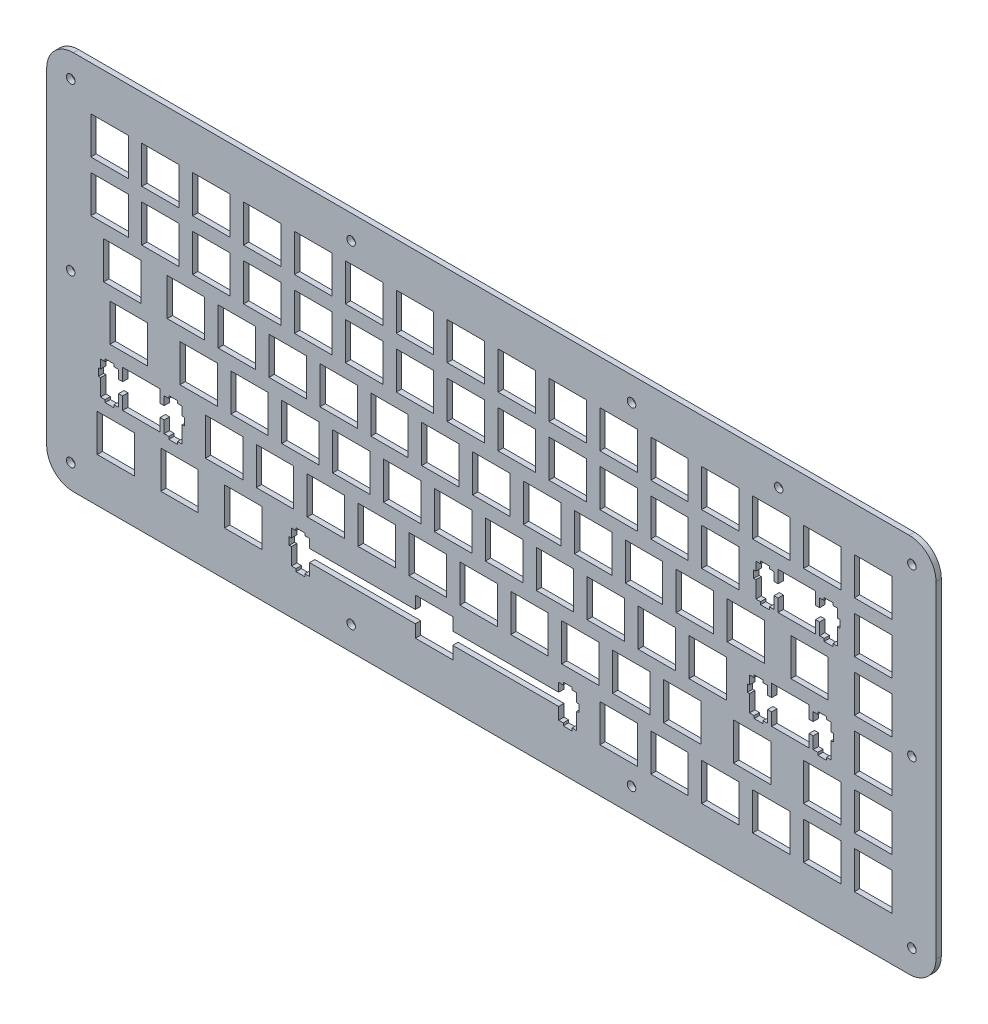
from build123d import *

# Parameters (mm, degrees)
SKETCH_1_R      = 1.59992
SKETCH_1_R_2    = 1.5998
SKETCH_1_R_3    = 1.6
EXTRUDE_1_DEPTH = 2
SKETCH_1_3_W    = 13.9995
SKETCH_1_3_H    = 14.0009
SKETCH_1_3_W_2  = 14.0007
SKETCH_1_3_W_3  = 13.9997
SKETCH_1_3_W_4  = 13.9996
SKETCH_1_3_H_2  = 13.9997
SKETCH_1_3_W_5  = 14.0009
SKETCH_1_3_H_3  = 13.9996
SKETCH_1_3_W_6  = 14.0001
SKETCH_1_3_W_7  = 14
SKETCH_1_3_W_8  = 13.999
SKETCH_1_3_W_9  = 13.9994
SKETCH_1_3_W_10 = 14.0008
SKETCH_1_3_H_4  = 13.9992
SKETCH_1_3_W_11 = 14.001
SKETCH_1_3_H_5  = 14
EXTRUDE_2_DEPTH = 2


with BuildPart() as part:
    # 草图1 → 凸台-拉伸1 (new body)
    with BuildSketch(Plane.XY):
        with BuildLine():
            Line((143.903291321, 67.766258356), (-168.898624079, 67.766258356))
            ThreePointArc((-168.898624079, 67.766258356), (-175.969691891, 64.837326167), (-178.898624079, 57.766258356))
            Line((-178.898624079, 57.766258356), (-178.898624079, -64.535827644))
            ThreePointArc((-178.898624079, -64.535827644), (-175.969691891, -71.606895456), (-168.898624079, -74.535827644))
            Line((-168.898624079, -74.535827644), (143.903291321, -74.535827644))
            ThreePointArc((143.903291321, -74.535827644), (150.974359133, -71.606895456), (153.903291321, -64.535827644))
            Line((153.903291321, -64.535827644), (153.903291321, 57.766258356))
            ThreePointArc((153.903291321, 57.766258356), (150.974359133, 64.837326167), (143.903291321, 67.766258356))
        make_face()
        with Locations((-169.898638679, -65.535841644)):
            Circle(SKETCH_1_R, mode=Mode.SUBTRACT)
        with Locations((-64.964708679, -65.535841644)):
            Circle(SKETCH_1_R, mode=Mode.SUBTRACT)
        with Locations((-169.898638679, -3.384841644)):
            Circle(SKETCH_1_R_2, mode=Mode.SUBTRACT)
        with Locations((39.968291321, -65.535841644)):
            Circle(SKETCH_1_R, mode=Mode.SUBTRACT)
        with Locations((144.903291321, -65.535841644)):
            Circle(SKETCH_1_R, mode=Mode.SUBTRACT)
        with Locations((144.903291321, -3.384841644)):
            Circle(SKETCH_1_R_2, mode=Mode.SUBTRACT)
        with BuildLine():
            ThreePointArc((-73.964708679, 56.241258356), (-73.378922242, 54.827044793), (-71.964708679, 54.241258356))
            Line((-71.964708679, 54.241258356), (-57.964708679, 54.241258356))
            ThreePointArc((-57.964708679, 54.241258356), (-56.550495117, 54.827044793), (-55.964708679, 56.241258356))
            Line((-55.964708679, 56.241258356), (-55.964708679, 59.766258356))
            ThreePointArc((-55.964708679, 59.766258356), (-55.378922242, 61.180471918), (-53.964708679, 61.766258356))
            Line((-53.964708679, 61.766258356), (28.968291321, 61.766258356))
            ThreePointArc((28.968291321, 61.766258356), (30.382504883, 61.180471918), (30.968291321, 59.766258356))
            Line((30.968291321, 59.766258356), (30.968291321, 56.241258356))
            ThreePointArc((30.968291321, 56.241258356), (31.554077758, 54.827044793), (32.968291321, 54.241258356))
            Line((32.968291321, 54.241258356), (46.968291321, 54.241258356))
            ThreePointArc((46.968291321, 54.241258356), (48.382504883, 54.827044793), (48.968291321, 56.241258356))
            Line((48.968291321, 56.241258356), (48.968291321, 59.766258356))
            ThreePointArc((48.968291321, 59.766258356), (49.554077758, 61.180471918), (50.968291321, 61.766258356))
            Line((50.968291321, 61.766258356), (84.036291321, 61.766258356))
            ThreePointArc((84.036291321, 61.766258356), (85.450504883, 61.180471918), (86.036291321, 59.766258356))
            Line((86.036291321, 59.766258356), (86.036291321, 56.241258356))
            ThreePointArc((86.036291321, 56.241258356), (86.622077758, 54.827044793), (88.036291321, 54.241258356))
            Line((88.036291321, 54.241258356), (102.036291321, 54.241258356))
            ThreePointArc((102.036291321, 54.241258356), (103.450504883, 54.827044793), (104.036291321, 56.241258356))
            Line((104.036291321, 56.241258356), (104.036291321, 59.766258356))
            ThreePointArc((104.036291321, 59.766258356), (104.622077758, 61.180471918), (106.036291321, 61.766258356))
            Line((106.036291321, 61.766258356), (133.903291321, 61.766258356))
            ThreePointArc((133.903291321, 61.766258356), (135.317504883, 61.180471918), (135.903291321, 59.766258356))
            Line((135.903291321, 59.766258356), (135.903291321, 56.241258356))
            ThreePointArc((135.903291321, 56.241258356), (136.489077758, 54.827044793), (137.903291321, 54.241258356))
            Line((137.903291321, 54.241258356), (138.376291321, 54.241258356))
            ThreePointArc((138.376291321, 54.241258356), (139.790504883, 53.655471918), (140.376291321, 52.241258356))
            Line((140.376291321, 52.241258356), (140.376291321, 51.766258356))
            ThreePointArc((140.376291321, 51.766258356), (140.962077758, 50.352044793), (142.376291321, 49.766258356))
            Line((142.376291321, 49.766258356), (145.903291321, 49.766258356))
            ThreePointArc((145.903291321, 49.766258356), (147.317504883, 49.180471918), (147.903291321, 47.766258356))
            Line((147.903291321, 47.766258356), (147.903291321, 7.615158356))
            ThreePointArc((147.903291321, 7.615158356), (147.317504883, 6.200944793), (145.903291321, 5.615158356))
            Line((145.903291321, 5.615158356), (142.376291321, 5.615158356))
            ThreePointArc((142.376291321, 5.615158356), (140.962077758, 5.029371918), (140.376291321, 3.615158356))
            Line((140.376291321, 3.615158356), (140.376291321, -10.384841644))
            ThreePointArc((140.376291321, -10.384841644), (140.962077758, -11.799055207), (142.376291321, -12.384841644))
            Line((142.376291321, -12.384841644), (145.903291321, -12.384841644))
            ThreePointArc((145.903291321, -12.384841644), (147.317504883, -12.970628082), (147.903291321, -14.384841644))
            Line((147.903291321, -14.384841644), (147.903291321, -54.535841644))
            ThreePointArc((147.903291321, -54.535841644), (147.317504883, -55.950055207), (145.903291321, -56.535841644))
            Line((145.903291321, -56.535841644), (142.376291321, -56.535841644))
            ThreePointArc((142.376291321, -56.535841644), (140.962077758, -57.121628082), (140.376291321, -58.535841644))
            Line((140.376291321, -58.535841644), (140.376291321, -59.009041644))
            ThreePointArc((140.376291321, -59.009041644), (139.790504883, -60.423255207), (138.376291321, -61.009041644))
            Line((138.376291321, -61.009041644), (137.903291321, -61.009041644))
            ThreePointArc((137.903291321, -61.009041644), (136.489077758, -61.594828082), (135.903291321, -63.009041644))
            Line((135.903291321, -63.009041644), (135.903291321, -66.535827644))
            ThreePointArc((135.903291321, -66.535827644), (135.317504883, -67.950041207), (133.903291321, -68.535827644))
            Line((133.903291321, -68.535827644), (50.968291321, -68.535827644))
            ThreePointArc((50.968291321, -68.535827644), (49.554077758, -67.950041207), (48.968291321, -66.535827644))
            Line((48.968291321, -66.535827644), (48.968291321, -63.009041644))
            ThreePointArc((48.968291321, -63.009041644), (48.382504883, -61.594828082), (46.968291321, -61.009041644))
            Line((46.968291321, -61.009041644), (32.968291321, -61.009041644))
            ThreePointArc((32.968291321, -61.009041644), (31.554077758, -61.594828082), (30.968291321, -63.009041644))
            Line((30.968291321, -63.009041644), (30.968291321, -66.535827644))
            ThreePointArc((30.968291321, -66.535827644), (30.382504883, -67.950041207), (28.968291321, -68.535827644))
            Line((28.968291321, -68.535827644), (-53.964708679, -68.535827644))
            ThreePointArc((-53.964708679, -68.535827644), (-55.378922242, -67.950041207), (-55.964708679, -66.535827644))
            Line((-55.964708679, -66.535827644), (-55.964708679, -63.009041644))
            ThreePointArc((-55.964708679, -63.009041644), (-56.550495117, -61.594828082), (-57.964708679, -61.009041644))
            Line((-57.964708679, -61.009041644), (-71.964708679, -61.009041644))
            ThreePointArc((-71.964708679, -61.009041644), (-73.378922242, -61.594828082), (-73.964708679, -63.009041644))
            Line((-73.964708679, -63.009041644), (-73.964708679, -66.535827644))
            ThreePointArc((-73.964708679, -66.535827644), (-74.550495117, -67.950041207), (-75.964708679, -68.535827644))
            Line((-75.964708679, -68.535827644), (-158.898638679, -68.535827644))
            ThreePointArc((-158.898638679, -68.535827644), (-160.312852242, -67.950041207), (-160.898638679, -66.535827644))
            Line((-160.898638679, -66.535827644), (-160.898638679, -63.009041644))
            ThreePointArc((-160.898638679, -63.009041644), (-161.484425117, -61.594828082), (-162.898638679, -61.009041644))
            Line((-162.898638679, -61.009041644), (-163.374508679, -61.009041644))
            ThreePointArc((-163.374508679, -61.009041644), (-164.788722242, -60.423255207), (-165.374508679, -59.009041644))
            Line((-165.374508679, -59.009041644), (-165.374508679, -58.535841644))
            ThreePointArc((-165.374508679, -58.535841644), (-165.960295117, -57.121628082), (-167.374508679, -56.535841644))
            Line((-167.374508679, -56.535841644), (-170.898624079, -56.535841644))
            ThreePointArc((-170.898624079, -56.535841644), (-172.312837642, -55.950055207), (-172.898624079, -54.535841644))
            Line((-172.898624079, -54.535841644), (-172.898624079, -14.384841644))
            ThreePointArc((-172.898624079, -14.384841644), (-172.312837642, -12.970628082), (-170.898624079, -12.384841644))
            Line((-170.898624079, -12.384841644), (-167.374508679, -12.384841644))
            ThreePointArc((-167.374508679, -12.384841644), (-165.960295117, -11.799055207), (-165.374508679, -10.384841644))
            Line((-165.374508679, -10.384841644), (-165.374508679, 3.615158356))
            ThreePointArc((-165.374508679, 3.615158356), (-165.960295117, 5.029371918), (-167.374508679, 5.615158356))
            Line((-167.374508679, 5.615158356), (-170.898624079, 5.615158356))
            ThreePointArc((-170.898624079, 5.615158356), (-172.312837642, 6.200944793), (-172.898624079, 7.615158356))
            Line((-172.898624079, 7.615158356), (-172.898624079, 47.766258356))
            ThreePointArc((-172.898624079, 47.766258356), (-172.312837642, 49.180471918), (-170.898624079, 49.766258356))
            Line((-170.898624079, 49.766258356), (-167.374508679, 49.766258356))
            ThreePointArc((-167.374508679, 49.766258356), (-165.960295117, 50.352044793), (-165.374508679, 51.766258356))
            Line((-165.374508679, 51.766258356), (-165.374508679, 52.241258356))
            ThreePointArc((-165.374508679, 52.241258356), (-164.788722242, 53.655471918), (-163.374508679, 54.241258356))
            Line((-163.374508679, 54.241258356), (-162.898638679, 54.241258356))
            ThreePointArc((-162.898638679, 54.241258356), (-161.484425117, 54.827044793), (-160.898638679, 56.241258356))
            Line((-160.898638679, 56.241258356), (-160.898638679, 59.766258356))
            ThreePointArc((-160.898638679, 59.766258356), (-160.312852242, 61.180471918), (-158.898638679, 61.766258356))
            Line((-158.898638679, 61.766258356), (-75.964708679, 61.766258356))
            ThreePointArc((-75.964708679, 61.766258356), (-74.550495117, 61.180471918), (-73.964708679, 59.766258356))
            Line((-73.964708679, 59.766258356), (-73.964708679, 56.241258356))
        make_face(mode=Mode.SUBTRACT)
        with Locations((-169.898638679, 58.766258356)):
            Circle(SKETCH_1_R_3, mode=Mode.SUBTRACT)
        with Locations((-64.964708679, 58.766258356)):
            Circle(SKETCH_1_R_3, mode=Mode.SUBTRACT)
        with Locations((39.968291321, 58.766258356)):
            Circle(SKETCH_1_R_3, mode=Mode.SUBTRACT)
        with Locations((95.036291321, 58.766258356)):
            Circle(SKETCH_1_R_3, mode=Mode.SUBTRACT)
        with Locations((144.903291321, 58.766258356)):
            Circle(SKETCH_1_R_3, mode=Mode.SUBTRACT)
    extrude(amount=EXTRUDE_1_DEPTH)

    # 草图1<3> → 凸台-拉伸2 (add)
    with BuildSketch(Plane.XY):
        with BuildLine():
            Line((-57.964708679, 54.241258356), (-71.964708679, 54.241258356))
            ThreePointArc((-71.964708679, 54.241258356), (-73.378922242, 54.827044793), (-73.964708679, 56.241258356))
            Line((-73.964708679, 56.241258356), (-73.964708679, 59.766258356))
            ThreePointArc((-73.964708679, 59.766258356), (-74.550495117, 61.180471918), (-75.964708679, 61.766258356))
            Line((-75.964708679, 61.766258356), (-158.898638679, 61.766258356))
            ThreePointArc((-158.898638679, 61.766258356), (-160.312852242, 61.180471918), (-160.898638679, 59.766258356))
            Line((-160.898638679, 59.766258356), (-160.898638679, 56.241258356))
            ThreePointArc((-160.898638679, 56.241258356), (-161.484425117, 54.827044793), (-162.898638679, 54.241258356))
            Line((-162.898638679, 54.241258356), (-163.374508679, 54.241258356))
            ThreePointArc((-163.374508679, 54.241258356), (-164.788722242, 53.655471918), (-165.374508679, 52.241258356))
            Line((-165.374508679, 52.241258356), (-165.374508679, 51.766258356))
            ThreePointArc((-165.374508679, 51.766258356), (-165.960295117, 50.352044793), (-167.374508679, 49.766258356))
            Line((-167.374508679, 49.766258356), (-170.898624079, 49.766258356))
            ThreePointArc((-170.898624079, 49.766258356), (-172.312837642, 49.180471918), (-172.898624079, 47.766258356))
            Line((-172.898624079, 47.766258356), (-172.898624079, 7.615158356))
            ThreePointArc((-172.898624079, 7.615158356), (-172.312837642, 6.200944793), (-170.898624079, 5.615158356))
            Line((-170.898624079, 5.615158356), (-167.374508679, 5.615158356))
            ThreePointArc((-167.374508679, 5.615158356), (-165.960295117, 5.029371918), (-165.374508679, 3.615158356))
            Line((-165.374508679, 3.615158356), (-165.374508679, -10.384841644))
            ThreePointArc((-165.374508679, -10.384841644), (-165.960295117, -11.799055207), (-167.374508679, -12.384841644))
            Line((-167.374508679, -12.384841644), (-170.898624079, -12.384841644))
            ThreePointArc((-170.898624079, -12.384841644), (-172.312837642, -12.970628082), (-172.898624079, -14.384841644))
            Line((-172.898624079, -14.384841644), (-172.898624079, -54.535841644))
            ThreePointArc((-172.898624079, -54.535841644), (-172.312837642, -55.950055207), (-170.898624079, -56.535841644))
            Line((-170.898624079, -56.535841644), (-167.374508679, -56.535841644))
            ThreePointArc((-167.374508679, -56.535841644), (-165.960295117, -57.121628082), (-165.374508679, -58.535841644))
            Line((-165.374508679, -58.535841644), (-165.374508679, -59.009041644))
            ThreePointArc((-165.374508679, -59.009041644), (-164.788722242, -60.423255207), (-163.374508679, -61.009041644))
            Line((-163.374508679, -61.009041644), (-162.898638679, -61.009041644))
            ThreePointArc((-162.898638679, -61.009041644), (-161.484425117, -61.594828082), (-160.898638679, -63.009041644))
            Line((-160.898638679, -63.009041644), (-160.898638679, -66.535827644))
            ThreePointArc((-160.898638679, -66.535827644), (-160.312852242, -67.950041207), (-158.898638679, -68.535827644))
            Line((-158.898638679, -68.535827644), (-75.964708679, -68.535827644))
            ThreePointArc((-75.964708679, -68.535827644), (-74.550495117, -67.950041207), (-73.964708679, -66.535827644))
            Line((-73.964708679, -66.535827644), (-73.964708679, -63.009041644))
            ThreePointArc((-73.964708679, -63.009041644), (-73.378922242, -61.594828082), (-71.964708679, -61.009041644))
            Line((-71.964708679, -61.009041644), (-57.964708679, -61.009041644))
            ThreePointArc((-57.964708679, -61.009041644), (-56.550495117, -61.594828082), (-55.964708679, -63.009041644))
            Line((-55.964708679, -63.009041644), (-55.964708679, -66.535827644))
            ThreePointArc((-55.964708679, -66.535827644), (-55.378922242, -67.950041207), (-53.964708679, -68.535827644))
            Line((-53.964708679, -68.535827644), (28.968291321, -68.535827644))
            ThreePointArc((28.968291321, -68.535827644), (30.382504883, -67.950041207), (30.968291321, -66.535827644))
            Line((30.968291321, -66.535827644), (30.968291321, -63.009041644))
            ThreePointArc((30.968291321, -63.009041644), (31.554077758, -61.594828082), (32.968291321, -61.009041644))
            Line((32.968291321, -61.009041644), (46.968291321, -61.009041644))
            ThreePointArc((46.968291321, -61.009041644), (48.382504883, -61.594828082), (48.968291321, -63.009041644))
            Line((48.968291321, -63.009041644), (48.968291321, -66.535827644))
            ThreePointArc((48.968291321, -66.535827644), (49.554077758, -67.950041207), (50.968291321, -68.535827644))
            Line((50.968291321, -68.535827644), (133.903291321, -68.535827644))
            ThreePointArc((133.903291321, -68.535827644), (135.317504883, -67.950041207), (135.903291321, -66.535827644))
            Line((135.903291321, -66.535827644), (135.903291321, -63.009041644))
            ThreePointArc((135.903291321, -63.009041644), (136.489077758, -61.594828082), (137.903291321, -61.009041644))
            Line((137.903291321, -61.009041644), (138.376291321, -61.009041644))
            ThreePointArc((138.376291321, -61.009041644), (139.790504883, -60.423255207), (140.376291321, -59.009041644))
            Line((140.376291321, -59.009041644), (140.376291321, -58.535841644))
            ThreePointArc((140.376291321, -58.535841644), (140.962077758, -57.121628082), (142.376291321, -56.535841644))
            Line((142.376291321, -56.535841644), (145.903291321, -56.535841644))
            ThreePointArc((145.903291321, -56.535841644), (147.317504883, -55.950055207), (147.903291321, -54.535841644))
            Line((147.903291321, -54.535841644), (147.903291321, -14.384841644))
            ThreePointArc((147.903291321, -14.384841644), (147.317504883, -12.970628082), (145.903291321, -12.384841644))
            Line((145.903291321, -12.384841644), (142.376291321, -12.384841644))
            ThreePointArc((142.376291321, -12.384841644), (140.962077758, -11.799055207), (140.376291321, -10.384841644))
            Line((140.376291321, -10.384841644), (140.376291321, 3.615158356))
            ThreePointArc((140.376291321, 3.615158356), (140.962077758, 5.029371918), (142.376291321, 5.615158356))
            Line((142.376291321, 5.615158356), (145.903291321, 5.615158356))
            ThreePointArc((145.903291321, 5.615158356), (147.317504883, 6.200944793), (147.903291321, 7.615158356))
            Line((147.903291321, 7.615158356), (147.903291321, 47.766258356))
            ThreePointArc((147.903291321, 47.766258356), (147.317504883, 49.180471918), (145.903291321, 49.766258356))
            Line((145.903291321, 49.766258356), (142.376291321, 49.766258356))
            ThreePointArc((142.376291321, 49.766258356), (140.962077758, 50.352044793), (140.376291321, 51.766258356))
            Line((140.376291321, 51.766258356), (140.376291321, 52.241258356))
            ThreePointArc((140.376291321, 52.241258356), (139.790504883, 53.655471918), (138.376291321, 54.241258356))
            Line((138.376291321, 54.241258356), (137.903291321, 54.241258356))
            ThreePointArc((137.903291321, 54.241258356), (136.489077758, 54.827044793), (135.903291321, 56.241258356))
            Line((135.903291321, 56.241258356), (135.903291321, 59.766258356))
            ThreePointArc((135.903291321, 59.766258356), (135.317504883, 61.180471918), (133.903291321, 61.766258356))
            Line((133.903291321, 61.766258356), (106.036291321, 61.766258356))
            ThreePointArc((106.036291321, 61.766258356), (104.622077758, 61.180471918), (104.036291321, 59.766258356))
            Line((104.036291321, 59.766258356), (104.036291321, 56.241258356))
            ThreePointArc((104.036291321, 56.241258356), (103.450504883, 54.827044793), (102.036291321, 54.241258356))
            Line((102.036291321, 54.241258356), (88.036291321, 54.241258356))
            ThreePointArc((88.036291321, 54.241258356), (86.622077758, 54.827044793), (86.036291321, 56.241258356))
            Line((86.036291321, 56.241258356), (86.036291321, 59.766258356))
            ThreePointArc((86.036291321, 59.766258356), (85.450504883, 61.180471918), (84.036291321, 61.766258356))
            Line((84.036291321, 61.766258356), (50.968291321, 61.766258356))
            ThreePointArc((50.968291321, 61.766258356), (49.554077758, 61.180471918), (48.968291321, 59.766258356))
            Line((48.968291321, 59.766258356), (48.968291321, 56.241258356))
            ThreePointArc((48.968291321, 56.241258356), (48.382504883, 54.827044793), (46.968291321, 54.241258356))
            Line((46.968291321, 54.241258356), (32.968291321, 54.241258356))
            ThreePointArc((32.968291321, 54.241258356), (31.554077758, 54.827044793), (30.968291321, 56.241258356))
            Line((30.968291321, 56.241258356), (30.968291321, 59.766258356))
            ThreePointArc((30.968291321, 59.766258356), (30.382504883, 61.180471918), (28.968291321, 61.766258356))
            Line((28.968291321, 61.766258356), (-53.964708679, 61.766258356))
            ThreePointArc((-53.964708679, 61.766258356), (-55.378922242, 61.180471918), (-55.964708679, 59.766258356))
            Line((-55.964708679, 59.766258356), (-55.964708679, 56.241258356))
            ThreePointArc((-55.964708679, 56.241258356), (-56.550495117, 54.827044793), (-57.964708679, 54.241258356))
        make_face()
        with Locations((-152.992158679, -51.008591644)):
            Rectangle(SKETCH_1_3_W, SKETCH_1_3_H, mode=Mode.SUBTRACT)
        with Locations((-129.180258679, -51.008591644)):
            Rectangle(SKETCH_1_3_W_2, SKETCH_1_3_H, mode=Mode.SUBTRACT)
        with Locations((-105.367258679, -51.008591644)):
            Rectangle(SKETCH_1_3_W_3, SKETCH_1_3_H, mode=Mode.SUBTRACT)
        Polygon((-40.930708679, -48.710041644), (-40.930708679, -44.008141644), (-26.929708679, -44.008141644), (-26.929708679, -48.710041644), (12.694291321, -48.710041644), (12.694291321, -45.478441644), (14.419291321, -45.478441644), (14.419291321, -44.557941644), (17.719291321, -44.557941644), (17.719291321, -45.478441644), (19.445291321, -45.478441644), (19.445291321, -48.710041644), (20.269291321, -48.710041644), (20.269291321, -51.508841644), (19.445291321, -51.508841644), (19.445291321, -57.778841644), (17.719291321, -57.778841644), (17.719291321, -58.758661644), (14.419291321, -58.758661644), (14.419291321, -57.778841644), (12.694291321, -57.778841644), (12.694291321, -53.308441644), (-26.929708679, -53.308441644), (-26.929708679, -58.009041644), (-40.930708679, -58.009041644), (-40.930708679, -53.308441644), (-80.555008679, -53.308441644), (-80.555008679, -57.778841644), (-82.280108679, -57.778841644), (-82.280108679, -58.758661644), (-85.580708679, -58.758661644), (-85.580708679, -57.778841644), (-87.304708679, -57.778841644), (-87.304708679, -51.508841644), (-88.129808679, -51.508841644), (-88.129808679, -48.710041644), (-87.304708679, -48.710041644), (-87.304708679, -45.478441644), (-85.580708679, -45.478441644), (-85.580708679, -44.557941644), (-82.280108679, -44.557941644), (-82.280108679, -45.478441644), (-80.555008679, -45.478441644), (-80.555008679, -48.710041644), align=None, mode=Mode.SUBTRACT)
        Polygon((-150.466908679, -29.660141644), (-150.466908679, -24.959341644), (-136.467408679, -24.959341644), (-136.467408679, -29.660141644), (-134.942008679, -29.660141644), (-134.942008679, -26.429741644), (-133.216608679, -26.429741644), (-133.216608679, -25.507941644), (-129.917808679, -25.507941644), (-129.917808679, -26.429741644), (-128.192308679, -26.429741644), (-128.192308679, -29.660141644), (-127.366808679, -29.660141644), (-127.366808679, -32.458641644), (-128.192308679, -32.458641644), (-128.192308679, -38.728841644), (-129.917808679, -38.728841644), (-129.917808679, -39.710041644), (-133.216608679, -39.710041644), (-133.216608679, -38.728841644), (-134.942008679, -38.728841644), (-134.942008679, -34.258441644), (-136.467408679, -34.258441644), (-136.467408679, -38.959041644), (-150.466908679, -38.959041644), (-150.466908679, -34.258441644), (-151.992408679, -34.258441644), (-151.992408679, -38.728841644), (-153.717708679, -38.728841644), (-153.717708679, -39.710041644), (-157.016708679, -39.710041644), (-157.016708679, -38.728841644), (-158.742008679, -38.728841644), (-158.742008679, -32.458641644), (-159.567508679, -32.458641644), (-159.567508679, -29.660141644), (-158.742008679, -29.660141644), (-158.742008679, -26.429741644), (-157.016708679, -26.429741644), (-157.016708679, -25.507941644), (-153.717708679, -25.507941644), (-153.717708679, -26.429741644), (-151.992408679, -26.429741644), (-151.992408679, -29.660141644), align=None, mode=Mode.SUBTRACT)
        with Locations((-112.511008679, -31.959191644)):
            Rectangle(SKETCH_1_3_W_4, SKETCH_1_3_H_2, mode=Mode.SUBTRACT)
        with Locations((-148.230358679, -12.909141644)):
            Rectangle(SKETCH_1_3_W_5, SKETCH_1_3_H_3, mode=Mode.SUBTRACT)
        with Locations((-122.036008679, -12.909141644)):
            Rectangle(SKETCH_1_3_W_4, SKETCH_1_3_H_3, mode=Mode.SUBTRACT)
        with Locations((-102.986008679, -12.909141644)):
            Rectangle(SKETCH_1_3_W_4, SKETCH_1_3_H_3, mode=Mode.SUBTRACT)
        with Locations((-93.461008679, -31.959191644)):
            Rectangle(SKETCH_1_3_W_4, SKETCH_1_3_H_2, mode=Mode.SUBTRACT)
        with Locations((-74.410758679, -31.959191644)):
            Rectangle(SKETCH_1_3_W_6, SKETCH_1_3_H_2, mode=Mode.SUBTRACT)
        with Locations((-55.360708679, -31.959191644)):
            Rectangle(SKETCH_1_3_W_7, SKETCH_1_3_H_2, mode=Mode.SUBTRACT)
        with Locations((-36.310708679, -31.959191644)):
            Rectangle(SKETCH_1_3_W_7, SKETCH_1_3_H_2, mode=Mode.SUBTRACT)
        with Locations((-17.260708679, -31.959191644)):
            Rectangle(SKETCH_1_3_W_7, SKETCH_1_3_H_2, mode=Mode.SUBTRACT)
        with Locations((-83.936008679, -12.909141644)):
            Rectangle(SKETCH_1_3_W_4, SKETCH_1_3_H_3, mode=Mode.SUBTRACT)
        with Locations((-64.885708679, -12.909141644)):
            Rectangle(SKETCH_1_3_W_7, SKETCH_1_3_H_3, mode=Mode.SUBTRACT)
        with Locations((-45.835708679, -12.909141644)):
            Rectangle(SKETCH_1_3_W_7, SKETCH_1_3_H_3, mode=Mode.SUBTRACT)
        with Locations((-26.785708679, -12.909141644)):
            Rectangle(SKETCH_1_3_W_7, SKETCH_1_3_H_3, mode=Mode.SUBTRACT)
        with Locations((35.126291321, -51.008591644)):
            Rectangle(SKETCH_1_3_W_7, SKETCH_1_3_H, mode=Mode.SUBTRACT)
        with Locations((54.176291321, -51.008591644)):
            Rectangle(SKETCH_1_3_W_7, SKETCH_1_3_H, mode=Mode.SUBTRACT)
        with Locations((73.226291321, -51.008591644)):
            Rectangle(SKETCH_1_3_W_7, SKETCH_1_3_H, mode=Mode.SUBTRACT)
        with Locations((92.276291321, -51.008591644)):
            Rectangle(SKETCH_1_3_W_7, SKETCH_1_3_H, mode=Mode.SUBTRACT)
        with Locations((111.326291321, -51.008591644)):
            Rectangle(SKETCH_1_3_W_7, SKETCH_1_3_H, mode=Mode.SUBTRACT)
        with Locations((130.376291321, -51.008591644)):
            Rectangle(SKETCH_1_3_W_7, SKETCH_1_3_H, mode=Mode.SUBTRACT)
        with Locations((1.789291321, -31.959191644)):
            Rectangle(SKETCH_1_3_W_7, SKETCH_1_3_H_2, mode=Mode.SUBTRACT)
        with Locations((20.839291321, -31.959191644)):
            Rectangle(SKETCH_1_3_W_7, SKETCH_1_3_H_2, mode=Mode.SUBTRACT)
        with Locations((39.889291321, -31.959191644)):
            Rectangle(SKETCH_1_3_W_7, SKETCH_1_3_H_2, mode=Mode.SUBTRACT)
        with Locations((58.939291321, -31.959191644)):
            Rectangle(SKETCH_1_3_W_7, SKETCH_1_3_H_2, mode=Mode.SUBTRACT)
        with Locations((-7.735708679, -12.909141644)):
            Rectangle(SKETCH_1_3_W_7, SKETCH_1_3_H_3, mode=Mode.SUBTRACT)
        with Locations((11.314291321, -12.909141644)):
            Rectangle(SKETCH_1_3_W_7, SKETCH_1_3_H_3, mode=Mode.SUBTRACT)
        with Locations((30.364291321, -12.909141644)):
            Rectangle(SKETCH_1_3_W_7, SKETCH_1_3_H_3, mode=Mode.SUBTRACT)
        with Locations((49.414291321, -12.909141644)):
            Rectangle(SKETCH_1_3_W_7, SKETCH_1_3_H_3, mode=Mode.SUBTRACT)
        with Locations((68.464291321, -12.909141644)):
            Rectangle(SKETCH_1_3_W_7, SKETCH_1_3_H_3, mode=Mode.SUBTRACT)
        with Locations((85.132791321, -31.959191644)):
            Rectangle(SKETCH_1_3_W_8, SKETCH_1_3_H_2, mode=Mode.SUBTRACT)
        with Locations((111.326291321, -31.959191644)):
            Rectangle(SKETCH_1_3_W_7, SKETCH_1_3_H_2, mode=Mode.SUBTRACT)
        with Locations((130.376291321, -31.959191644)):
            Rectangle(SKETCH_1_3_W_7, SKETCH_1_3_H_2, mode=Mode.SUBTRACT)
        Polygon((92.419291321, -10.610141644), (92.419291321, -5.909341644), (106.420291321, -5.909341644), (106.420291321, -10.610141644), (107.944291321, -10.610141644), (107.944291321, -7.379741644), (109.669291321, -7.379741644), (109.669291321, -6.459341644), (112.969291321, -6.459341644), (112.969291321, -7.379741644), (114.695291321, -7.379741644), (114.695291321, -10.610141644), (115.519291321, -10.610141644), (115.519291321, -13.408641644), (114.695291321, -13.408641644), (114.695291321, -19.678941644), (112.969291321, -19.678941644), (112.969291321, -20.660041644), (109.669291321, -20.660041644), (109.669291321, -19.678941644), (107.944291321, -19.678941644), (107.944291321, -15.209941644), (106.420291321, -15.209941644), (106.420291321, -19.908941644), (92.419291321, -19.908941644), (92.419291321, -15.209941644), (90.895291321, -15.209941644), (90.895291321, -19.678941644), (89.170291321, -19.678941644), (89.170291321, -20.660041644), (85.869291321, -20.660041644), (85.869291321, -19.678941644), (84.145291321, -19.678941644), (84.145291321, -13.408641644), (83.320291321, -13.408641644), (83.320291321, -10.610141644), (84.145291321, -10.610141644), (84.145291321, -7.379741644), (85.869291321, -7.379741644), (85.869291321, -6.459341644), (89.170291321, -6.459341644), (89.170291321, -7.379741644), (90.895291321, -7.379741644), (90.895291321, -10.610141644), align=None, mode=Mode.SUBTRACT)
        with Locations((130.376291321, -12.909141644)):
            Rectangle(SKETCH_1_3_W_7, SKETCH_1_3_H_3, mode=Mode.SUBTRACT)
        with Locations((-150.610908679, 6.140858356)):
            Rectangle(SKETCH_1_3_W_9, SKETCH_1_3_H_3, mode=Mode.SUBTRACT)
        with Locations((-126.798508679, 6.140858356)):
            Rectangle(SKETCH_1_3_W_4, SKETCH_1_3_H_3, mode=Mode.SUBTRACT)
        with Locations((-107.748508679, 6.140858356)):
            Rectangle(SKETCH_1_3_W_4, SKETCH_1_3_H_3, mode=Mode.SUBTRACT)
        with Locations((-155.374108679, 25.190658356)):
            Rectangle(SKETCH_1_3_W_10, SKETCH_1_3_H_4, mode=Mode.SUBTRACT)
        with Locations((-136.323408679, 25.190658356)):
            Rectangle(SKETCH_1_3_W_9, SKETCH_1_3_H_4, mode=Mode.SUBTRACT)
        with Locations((-117.273508679, 25.190658356)):
            Rectangle(SKETCH_1_3_W_4, SKETCH_1_3_H_4, mode=Mode.SUBTRACT)
        with Locations((-98.223508679, 25.190658356)):
            Rectangle(SKETCH_1_3_W_4, SKETCH_1_3_H_4, mode=Mode.SUBTRACT)
        with Locations((-88.698508679, 6.140858356)):
            Rectangle(SKETCH_1_3_W_4, SKETCH_1_3_H_3, mode=Mode.SUBTRACT)
        with Locations((-69.648508679, 6.140858356)):
            Rectangle(SKETCH_1_3_W_4, SKETCH_1_3_H_3, mode=Mode.SUBTRACT)
        with Locations((-50.598708679, 6.140858356)):
            Rectangle(SKETCH_1_3_W_7, SKETCH_1_3_H_3, mode=Mode.SUBTRACT)
        with Locations((-31.548708679, 6.140858356)):
            Rectangle(SKETCH_1_3_W_7, SKETCH_1_3_H_3, mode=Mode.SUBTRACT)
        with Locations((-12.498708679, 6.140858356)):
            Rectangle(SKETCH_1_3_W_7, SKETCH_1_3_H_3, mode=Mode.SUBTRACT)
        with Locations((-79.173508679, 25.190658356)):
            Rectangle(SKETCH_1_3_W_4, SKETCH_1_3_H_4, mode=Mode.SUBTRACT)
        with Locations((-60.124208679, 25.190658356)):
            Rectangle(SKETCH_1_3_W_11, SKETCH_1_3_H_4, mode=Mode.SUBTRACT)
        with Locations((-41.074208679, 25.190658356)):
            Rectangle(SKETCH_1_3_W_11, SKETCH_1_3_H_4, mode=Mode.SUBTRACT)
        with Locations((-22.023708679, 25.190658356)):
            Rectangle(SKETCH_1_3_W_7, SKETCH_1_3_H_4, mode=Mode.SUBTRACT)
        with Locations((-155.374108679, 44.241258356)):
            Rectangle(SKETCH_1_3_W_10, SKETCH_1_3_H_5, mode=Mode.SUBTRACT)
        with Locations((-136.323408679, 44.241258356)):
            Rectangle(SKETCH_1_3_W_9, SKETCH_1_3_H_5, mode=Mode.SUBTRACT)
        with Locations((-117.273508679, 44.241258356)):
            Rectangle(SKETCH_1_3_W_4, SKETCH_1_3_H_5, mode=Mode.SUBTRACT)
        with Locations((-98.223508679, 44.241258356)):
            Rectangle(SKETCH_1_3_W_4, SKETCH_1_3_H_5, mode=Mode.SUBTRACT)
        with Locations((-79.173508679, 44.241258356)):
            Rectangle(SKETCH_1_3_W_4, SKETCH_1_3_H_5, mode=Mode.SUBTRACT)
        with Locations((-60.124208679, 44.241258356)):
            Rectangle(SKETCH_1_3_W_11, SKETCH_1_3_H_5, mode=Mode.SUBTRACT)
        with Locations((-41.074208679, 44.241258356)):
            Rectangle(SKETCH_1_3_W_11, SKETCH_1_3_H_5, mode=Mode.SUBTRACT)
        with Locations((-22.023708679, 44.241258356)):
            Rectangle(SKETCH_1_3_W_7, SKETCH_1_3_H_5, mode=Mode.SUBTRACT)
        with Locations((6.551291321, 6.140858356)):
            Rectangle(SKETCH_1_3_W_7, SKETCH_1_3_H_3, mode=Mode.SUBTRACT)
        with Locations((25.601291321, 6.140858356)):
            Rectangle(SKETCH_1_3_W_7, SKETCH_1_3_H_3, mode=Mode.SUBTRACT)
        with Locations((44.651291321, 6.140858356)):
            Rectangle(SKETCH_1_3_W_7, SKETCH_1_3_H_3, mode=Mode.SUBTRACT)
        with Locations((63.701291321, 6.140858356)):
            Rectangle(SKETCH_1_3_W_7, SKETCH_1_3_H_3, mode=Mode.SUBTRACT)
        with Locations((-2.973708679, 25.190658356)):
            Rectangle(SKETCH_1_3_W_7, SKETCH_1_3_H_4, mode=Mode.SUBTRACT)
        with Locations((16.076291321, 25.190658356)):
            Rectangle(SKETCH_1_3_W_7, SKETCH_1_3_H_4, mode=Mode.SUBTRACT)
        with Locations((35.126291321, 25.190658356)):
            Rectangle(SKETCH_1_3_W_7, SKETCH_1_3_H_4, mode=Mode.SUBTRACT)
        with Locations((54.176291321, 25.190658356)):
            Rectangle(SKETCH_1_3_W_7, SKETCH_1_3_H_4, mode=Mode.SUBTRACT)
        with Locations((82.751291321, 6.140858356)):
            Rectangle(SKETCH_1_3_W_7, SKETCH_1_3_H_3, mode=Mode.SUBTRACT)
        with Locations((106.564291321, 6.140858356)):
            Rectangle(SKETCH_1_3_W_7, SKETCH_1_3_H_3, mode=Mode.SUBTRACT)
        with Locations((130.376291321, 6.140858356)):
            Rectangle(SKETCH_1_3_W_7, SKETCH_1_3_H_3, mode=Mode.SUBTRACT)
        with Locations((73.226291321, 25.190658356)):
            Rectangle(SKETCH_1_3_W_7, SKETCH_1_3_H_4, mode=Mode.SUBTRACT)
        Polygon((94.801291321, 27.489858356), (94.801291321, 32.190258356), (108.801291321, 32.190258356), (108.801291321, 27.489858356), (110.326291321, 27.489858356), (110.326291321, 30.720258356), (112.052291321, 30.720258356), (112.052291321, 31.640258356), (115.351291321, 31.640258356), (115.351291321, 30.720258356), (117.076291321, 30.720258356), (117.076291321, 27.489858356), (117.902291321, 27.489858356), (117.902291321, 24.691358356), (117.076291321, 24.691358356), (117.076291321, 18.421058356), (115.351291321, 18.421058356), (115.351291321, 17.439958356), (112.052291321, 17.439958356), (112.052291321, 18.421058356), (110.326291321, 18.421058356), (110.326291321, 22.890058356), (108.801291321, 22.890058356), (108.801291321, 18.191058356), (94.801291321, 18.191058356), (94.801291321, 22.890058356), (93.276291321, 22.890058356), (93.276291321, 18.421058356), (91.552291321, 18.421058356), (91.552291321, 17.439958356), (88.252291321, 17.439958356), (88.252291321, 18.421058356), (86.526291321, 18.421058356), (86.526291321, 24.691358356), (85.701291321, 24.691358356), (85.701291321, 27.489858356), (86.526291321, 27.489858356), (86.526291321, 30.720258356), (88.252291321, 30.720258356), (88.252291321, 31.640258356), (91.552291321, 31.640258356), (91.552291321, 30.720258356), (93.276291321, 30.720258356), (93.276291321, 27.489858356), align=None, mode=Mode.SUBTRACT)
        with Locations((130.376291321, 25.190658356)):
            Rectangle(SKETCH_1_3_W_7, SKETCH_1_3_H_4, mode=Mode.SUBTRACT)
        with Locations((-2.973708679, 44.241258356)):
            Rectangle(SKETCH_1_3_W_7, SKETCH_1_3_H_5, mode=Mode.SUBTRACT)
        with Locations((16.076291321, 44.241258356)):
            Rectangle(SKETCH_1_3_W_7, SKETCH_1_3_H_5, mode=Mode.SUBTRACT)
        with Locations((35.126291321, 44.241258356)):
            Rectangle(SKETCH_1_3_W_7, SKETCH_1_3_H_5, mode=Mode.SUBTRACT)
        with Locations((54.176291321, 44.241258356)):
            Rectangle(SKETCH_1_3_W_7, SKETCH_1_3_H_5, mode=Mode.SUBTRACT)
        with Locations((73.226291321, 44.241258356)):
            Rectangle(SKETCH_1_3_W_7, SKETCH_1_3_H_5, mode=Mode.SUBTRACT)
        with Locations((92.276291321, 44.241258356)):
            Rectangle(SKETCH_1_3_W_7, SKETCH_1_3_H_5, mode=Mode.SUBTRACT)
        with Locations((111.326291321, 44.241258356)):
            Rectangle(SKETCH_1_3_W_7, SKETCH_1_3_H_5, mode=Mode.SUBTRACT)
        with Locations((130.376291321, 44.241258356)):
            Rectangle(SKETCH_1_3_W_7, SKETCH_1_3_H_5, mode=Mode.SUBTRACT)
    extrude(amount=EXTRUDE_2_DEPTH)


solid = part.part
